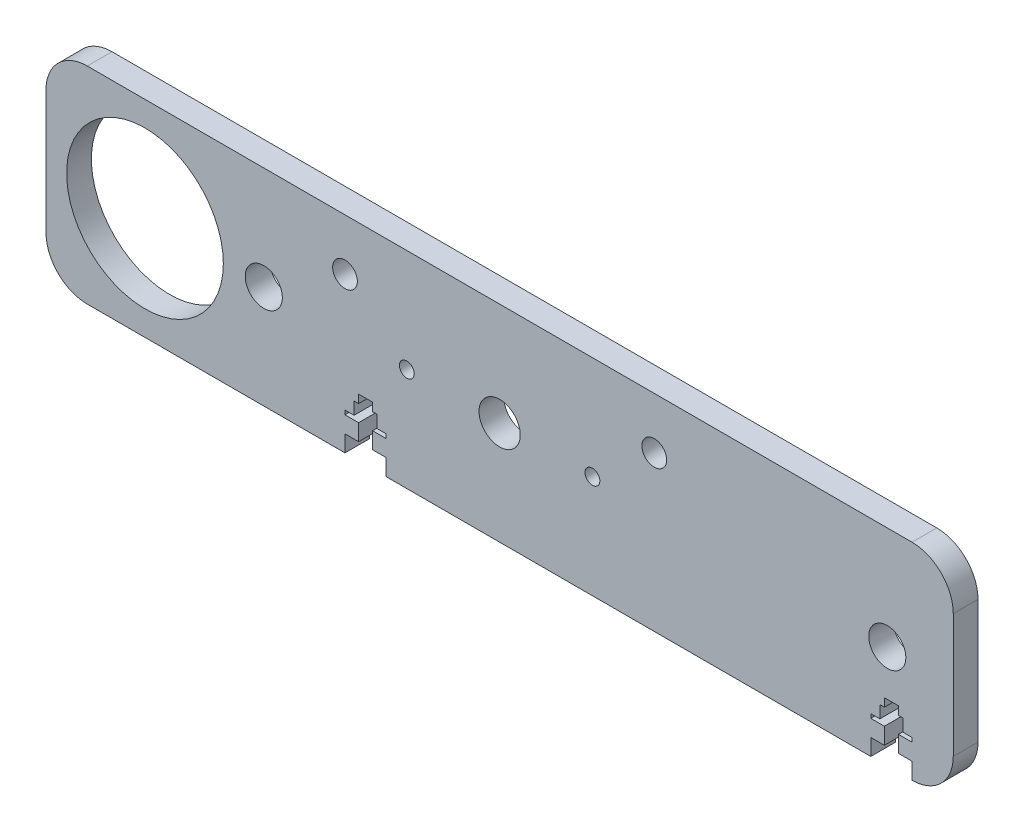
from build123d import *

# Parameters (mm, degrees)
ESBO_O1_R                = 19
ESBO_O1_R_2              = 4.5
ESBO_O1_R_3              = 1.8
ESBO_O1_R_4              = 5
ESBO_O1_R_5              = 3
RESSALTO_EXTRUS_O1_DEPTH = 6


with BuildPart() as part:
    # Esboço1 → Ressalto-extrusão1 (new body)
    with BuildSketch(Plane.XY):
        with BuildLine():
            Line((100, -21), (100, -25))
            ThreePointArc((100, -25), (107.071067812, -22.071067812), (110, -15))
            Line((110, -15), (110, 15))
            ThreePointArc((110, 15), (107.071067812, 22.071067812), (100, 25))
            Line((100, 25), (-100, 25))
            ThreePointArc((-100, 25), (-107.071067812, 22.071067812), (-110, 15))
            Line((-110, 15), (-110, -15))
            ThreePointArc((-110, -15), (-107.071067812, -22.071067812), (-100, -25))
            Line((-100, -25), (-37.5, -25))
            Line((-37.5, -25), (-37.5, -21))
            Line((-37.5, -21), (-34.2, -21))
            Line((-34.2, -21), (-34.2, -17))
            Line((-34.2, -17), (-37.5, -17))
            Line((-37.5, -17), (-37.5, -16))
            Line((-37.5, -16), (-35.3, -16))
            Line((-35.3, -16), (-35.3, -13))
            Line((-35.3, -13), (-34.2, -13))
            Line((-34.2, -13), (-34.2, -11))
            Line((-34.2, -11), (-30.8, -11))
            Line((-30.8, -11), (-30.8, -13))
            Line((-30.8, -13), (-29.7, -13))
            Line((-29.7, -13), (-29.7, -16))
            Line((-29.7, -16), (-27.5, -16))
            Line((-27.5, -16), (-27.5, -17))
            Line((-27.5, -17), (-30.8, -17))
            Line((-30.8, -17), (-30.8, -21))
            Line((-30.8, -21), (-27.5, -21))
            Line((-27.5, -21), (-27.5, -25))
            Line((-27.5, -25), (90, -25))
            Line((90, -25), (90, -21))
            Line((90, -21), (93.3, -21))
            Line((93.3, -21), (93.3, -17))
            Line((93.3, -17), (90, -17))
            Line((90, -17), (90, -16))
            Line((90, -16), (92.2, -16))
            Line((92.2, -16), (92.2, -13))
            Line((92.2, -13), (93.3, -13))
            Line((93.3, -13), (93.3, -11))
            Line((93.3, -11), (96.7, -11))
            Line((96.7, -11), (96.7, -13))
            Line((96.7, -13), (97.8, -13))
            Line((97.8, -13), (97.8, -16))
            Line((97.8, -16), (100, -16))
            Line((100, -16), (100, -17))
            Line((100, -17), (96.7, -17))
            Line((96.7, -17), (96.7, -21))
            Line((96.7, -21), (100, -21))
        make_face()
        with Locations((-86, 0)):
            Circle(ESBO_O1_R, mode=Mode.SUBTRACT)
        with Locations((-57.19, 0)):
            Circle(ESBO_O1_R_2, mode=Mode.SUBTRACT)
        with Locations((-22.5, 0)):
            Circle(ESBO_O1_R_3, mode=Mode.SUBTRACT)
        Circle(ESBO_O1_R_4, mode=Mode.SUBTRACT)
        with Locations((94, 0)):
            Circle(ESBO_O1_R_2, mode=Mode.SUBTRACT)
        with Locations((-37.5, 12.5)):
            Circle(ESBO_O1_R_5, mode=Mode.SUBTRACT)
        with Locations((22.5, 0)):
            Circle(ESBO_O1_R_3, mode=Mode.SUBTRACT)
        with Locations((37.5, 12.5)):
            Circle(ESBO_O1_R_5, mode=Mode.SUBTRACT)
    extrude(amount=RESSALTO_EXTRUS_O1_DEPTH)


solid = part.part
